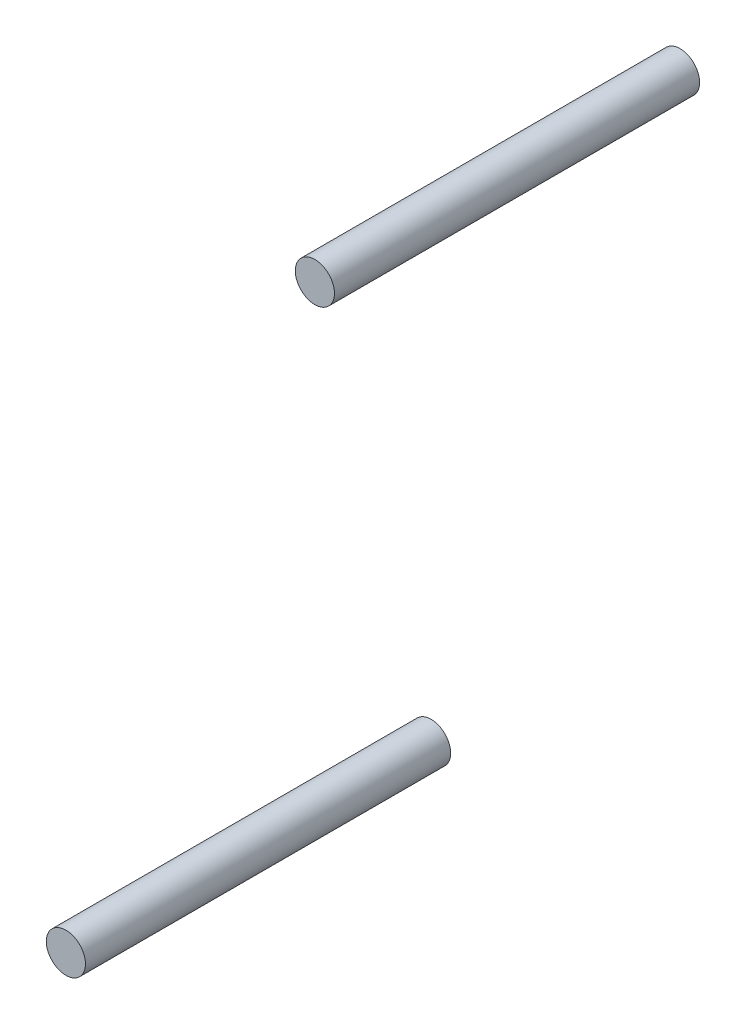
from build123d import *

# Parameters (mm, degrees)
BOSS_EXTRUDE1_START     = -118.461205854
BOSS_EXTRUDE1_OUTLINE_R = 6.35
BOSS_EXTRUDE1_DEPTH     = 118.461205854
SKETCH3_R               = 6.35
BOSS_EXTRUDE2_DEPTH     = 118.461205854


# Read off the part's stored shape, not the designer's step: Boss-Extrude1
with BuildPart() as part:
    # Boss-Extrude1 outline → Boss-Extrude1 (new body)
    with BuildSketch(Plane.XY.offset(420.9161).offset(BOSS_EXTRUDE1_START)):
        with Locations((62.725916196, -201.352329346)):
            Circle(BOSS_EXTRUDE1_OUTLINE_R)
    extrude(amount=BOSS_EXTRUDE1_DEPTH)


with BuildPart() as body_2:
    # Sketch3 → Boss-Extrude2 (new body)
    with BuildSketch(Plane.XY.offset(420.9161)):
        with Locations((-18.033383804, -430.130129346)):
            Circle(SKETCH3_R)
    extrude(amount=-BOSS_EXTRUDE2_DEPTH)


solid = Compound([part.part, body_2.part])
